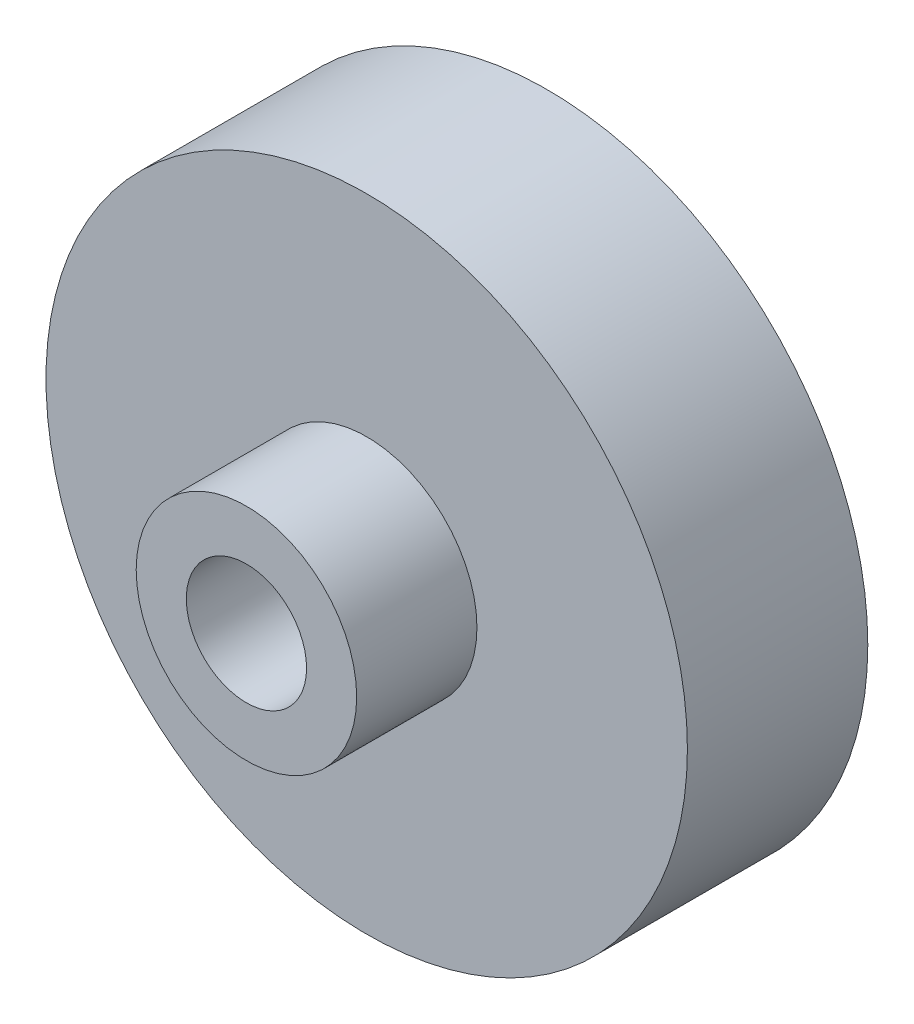
from build123d import *

# Parameters (mm, degrees)
SKETCH_1_R          = 16
EXTRUDE_1_DEPTH     = 9
SKETCH_2_R          = 6
EXTRUDE_2_DEPTH     = 0.5
SKETCH_3_R          = 16
EXTRUDE_3_DEPTH     = 3.25
SKETCH_4_R          = 5.5
EXTRUDE_4_DEPTH     = 2.25
SKETCH_5_R          = 3
CUT_EXTRUDE_1_DEPTH = 26.25
CUT_EXTRUDE_START   = -2.25
SKETCH_6_R          = 8
SKETCH_6_R_2        = 5.5
CUT_EXTRUDE_2_DEPTH = 2.25
SKETCH_7_R          = 0.6
CUT_EXTRUDE_3_DEPTH = 6
SKETCH_8_R          = 0.6
CUT_EXTRUDE_4_DEPTH = 3
CUT_EXTRUDE_START_2 = -3.75
SKETCH_9_R          = 18.290801542
SKETCH_9_R_2        = 5.5
CUT_EXTRUDE_5_DEPTH = 3.75


with BuildPart() as part:
    # 草图1 → 凸台-拉伸1 (new body)
    with BuildSketch(Plane.XY):
        Circle(SKETCH_1_R)
    extrude(amount=EXTRUDE_1_DEPTH)

    # 草图2 → 凸台-拉伸2 (add)
    with BuildSketch(Plane.XY.offset(9)):
        Circle(SKETCH_2_R)
    extrude(amount=EXTRUDE_2_DEPTH)

    # 草图3 → 凸台-拉伸3 (add)
    with BuildSketch(Plane.XY.offset(9.5)):
        Circle(SKETCH_3_R)
    extrude(amount=EXTRUDE_3_DEPTH)

    # 草图4 → 凸台-拉伸4 (add)
    with BuildSketch(Plane.XY.offset(12.75)):
        Circle(SKETCH_4_R)
    extrude(amount=EXTRUDE_4_DEPTH)

    # 草图5 → 切除-拉伸1 (cut)
    with BuildSketch(Plane.XY.offset(15)):
        Circle(SKETCH_5_R)
    extrude(amount=-CUT_EXTRUDE_1_DEPTH, mode=Mode.SUBTRACT)

    # 草图6 → 切除-拉伸2 (cut)
    with BuildSketch(Plane.XY.offset(12.75).offset(CUT_EXTRUDE_START)):
        Circle(SKETCH_6_R)
        Circle(SKETCH_6_R_2, mode=Mode.SUBTRACT)
    extrude(amount=CUT_EXTRUDE_2_DEPTH, mode=Mode.SUBTRACT)

    # 草图7 → 切除-拉伸3 (cut)
    with BuildSketch(Plane(origin=(0, 0, 0), x_dir=(-1, 0, 0), z_dir=(0, 0, -1))):
        with Locations((8.660254038, 5)):
            Circle(SKETCH_7_R)
        with Locations((-8.660254038, 5)):
            Circle(SKETCH_7_R)
        with Locations((0, -10)):
            Circle(SKETCH_7_R)
    extrude(amount=-CUT_EXTRUDE_3_DEPTH, mode=Mode.SUBTRACT)

    # 草图8 → 切除-拉伸4 (cut)
    with BuildSketch(Plane.XY.offset(12.75)):
        with Locations((5, -8.660254038)):
            Circle(SKETCH_8_R)
        with Locations((5, 8.660254038)):
            Circle(SKETCH_8_R)
        with Locations((-10, 0)):
            Circle(SKETCH_8_R)
    extrude(amount=-CUT_EXTRUDE_4_DEPTH, mode=Mode.SUBTRACT)

    # 草图9 → 切除-拉伸5 (cut)
    with BuildSketch(Plane.XY.offset(12.75).offset(CUT_EXTRUDE_START_2)):
        Circle(SKETCH_9_R)
        Circle(SKETCH_9_R_2, mode=Mode.SUBTRACT)
    extrude(amount=CUT_EXTRUDE_5_DEPTH, mode=Mode.SUBTRACT)


solid = part.part
